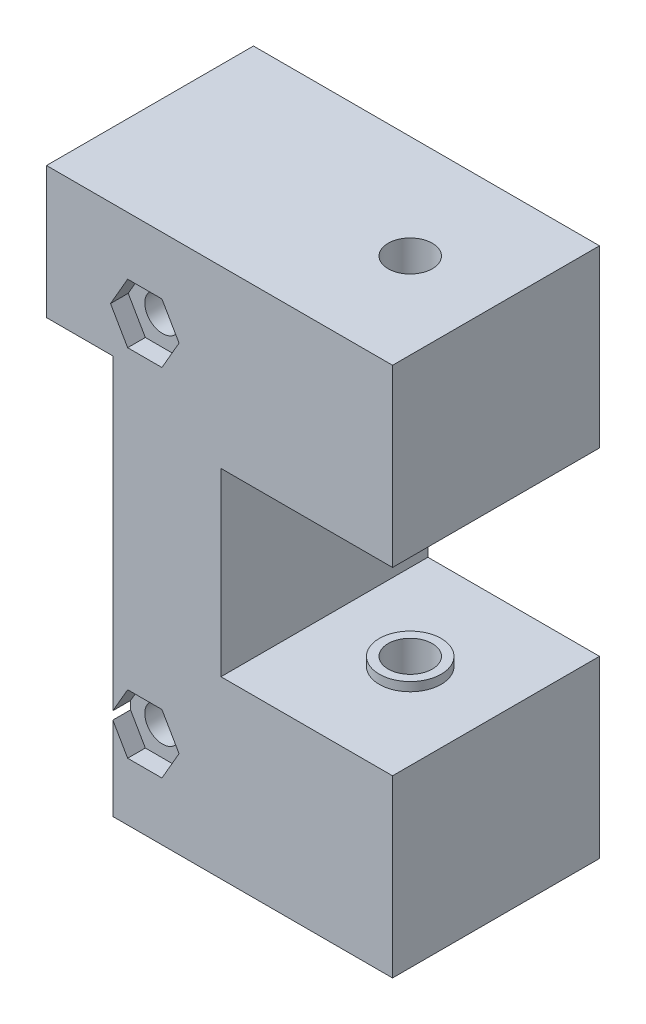
from build123d import *

# Parameters (mm, degrees)
MAINBLOCK_R                     = 2
MAINBLOCKBOSS_EXTRUDE1_DEPTH    = 23.4
TOPHOLECUT_SKETCH2_R            = 2.5
TOPHOLECUT_EXTRUDE1_DEPTH       = 45
MOUNTHOLEBORECUT_EXTRUDE2_DEPTH = 2
TOPSPACERSKETCH4_R              = 3.5
TOPSPACERSKETCH4_R_2            = 2.5
TOPSPACERBOSS_EXTRUDE2_DEPTH    = 1
LOWERSPACERBOSS_EXTRUDE3_START  = 1
LOWERSPACERSKETCH5_R            = 3.5
LOWERSPACERSKETCH5_R_2          = 2.5
LOWERSPACERBOSS_EXTRUDE3_DEPTH  = 1
PUSHPINHOLESKETCH1_R            = 1
PUSHPINHOLECUT_EXTRUDE1_DEPTH   = 76.354665582
MIDRAILINDENTSKETCH1_W          = 7.5
MIDRAILINDENTSKETCH1_H          = 45.1
MIDRAILINDENTCUT_EXTRUDE1_DEPTH = 76.354665582


with BuildPart() as part:
    # MainBlock → MainBlockBoss-Extrude1 (new body)
    with BuildSketch(Plane.XY):
        Polygon((0, 0), (39.125, 0), (39.125, 19.8), (19.725, 19.8), (19.725, 40.2), (39.125, 40.2), (39.125, 60), (0, 60), align=None)
        with Locations((11.1125, 50.1)):
            Circle(MAINBLOCK_R, mode=Mode.SUBTRACT)
        with Locations((11.1125, 9.9)):
            Circle(MAINBLOCK_R, mode=Mode.SUBTRACT)
    extrude(amount=MAINBLOCKBOSS_EXTRUDE1_DEPTH)

    # TopHoleCut-Sketch2 → TopHoleCut-Extrude1 (cut)
    with BuildSketch(Plane(origin=(0, 60, 0), x_dir=(1, 0, 0), z_dir=(0, 1, 0))):
        with Locations((29.425, -11.7)):
            Circle(TOPHOLECUT_SKETCH2_R)
    extrude(amount=-TOPHOLECUT_EXTRUDE1_DEPTH, mode=Mode.SUBTRACT)

    # MountHoleBoreSketch3 → MountHoleBoreCut-Extrude2 (cut)
    with BuildSketch(Plane.XY.offset(23.4)):
        Polygon((14.9875, 50.1), (13.05, 53.45584844), (9.175, 53.45584844), (7.2375, 50.1), (9.175, 46.74415156), (13.05, 46.74415156), align=None)
        Polygon((14.9875, 9.9), (13.05, 13.25584844), (9.175, 13.25584844), (7.2375, 9.9), (9.175, 6.54415156), (13.05, 6.54415156), align=None)
    extrude(amount=-MOUNTHOLEBORECUT_EXTRUDE2_DEPTH, mode=Mode.SUBTRACT)

    # TopSpacerSketch4 → TopSpacerBoss-Extrude2 (add)
    with BuildSketch(Plane.XZ.offset(-40.2)):
        with Locations((29.425, 11.7)):
            Circle(TOPSPACERSKETCH4_R)
        with Locations((29.425, 11.7)):
            Circle(TOPSPACERSKETCH4_R_2, mode=Mode.SUBTRACT)
    extrude(amount=TOPSPACERBOSS_EXTRUDE2_DEPTH)

    # LowerSpacerSketch5 → LowerSpacerBoss-Extrude3 (add)
    with BuildSketch(Plane(origin=(0, 19.8, 0), x_dir=(1, 0, 0), z_dir=(0, 1, 0)).offset(LOWERSPACERBOSS_EXTRUDE3_START)):
        with Locations((29.425, -11.7)):
            Circle(LOWERSPACERSKETCH5_R)
        with Locations((29.425, -11.7)):
            Circle(LOWERSPACERSKETCH5_R_2, mode=Mode.SUBTRACT)
    extrude(amount=-LOWERSPACERBOSS_EXTRUDE3_DEPTH)

    # PushPinHoleSketch1 → PushPinHoleCut-Extrude1 (cut, through all)
    with BuildSketch(Plane.XZ):
        with Locations((29.425, 11.7)):
            Circle(PUSHPINHOLESKETCH1_R)
    extrude(amount=-PUSHPINHOLECUT_EXTRUDE1_DEPTH, mode=Mode.SUBTRACT)

    # MidRailIndentSketch1 → MidRailIndentCut-Extrude1 (cut, through all)
    with BuildSketch(Plane.XY.offset(23.4)):
        with Locations((3.75, 22.55)):
            Rectangle(MIDRAILINDENTSKETCH1_W, MIDRAILINDENTSKETCH1_H)
    extrude(amount=-MIDRAILINDENTCUT_EXTRUDE1_DEPTH, mode=Mode.SUBTRACT)


solid = part.part
